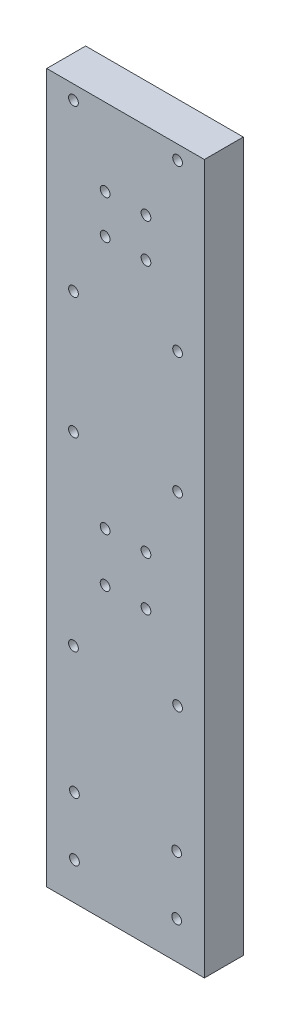
from build123d import *

# Parameters (mm, degrees)
SKETCH1_W           = 16.2
SKETCH1_H           = 72.846448831
SKETCH1_R           = 0.5
BOSS_EXTRUDE1_DEPTH = 4


with BuildPart() as part:
    # Sketch1 → Boss-Extrude1 (new body)
    with BuildSketch(Plane.XY):
        with Locations((8.1, 36.423224416)):
            Rectangle(SKETCH1_W, SKETCH1_H)
        with Locations((6, 29.846448831)):
            Circle(SKETCH1_R, mode=Mode.SUBTRACT)
        with Locations((10.2, 29.846448831)):
            Circle(SKETCH1_R, mode=Mode.SUBTRACT)
        with Locations((10.2, 34.892897662)):
            Circle(SKETCH1_R, mode=Mode.SUBTRACT)
        with Locations((10.2, 60.892897662)):
            Circle(SKETCH1_R, mode=Mode.SUBTRACT)
        with Locations((13.45, 54.392897662)):
            Circle(SKETCH1_R, mode=Mode.SUBTRACT)
        with Locations((6, 60.892897662)):
            Circle(SKETCH1_R, mode=Mode.SUBTRACT)
        with Locations((6, 34.892897662)):
            Circle(SKETCH1_R, mode=Mode.SUBTRACT)
        with Locations((2.75, 41.892897662)):
            Circle(SKETCH1_R, mode=Mode.SUBTRACT)
        with Locations((2.85, 9.846448831)):
            Circle(SKETCH1_R, mode=Mode.SUBTRACT)
        with Locations((13.35, 9.846448831)):
            Circle(SKETCH1_R, mode=Mode.SUBTRACT)
        with Locations((13.35, 3.846448831)):
            Circle(SKETCH1_R, mode=Mode.SUBTRACT)
        with Locations((2.85, 3.846448831)):
            Circle(SKETCH1_R, mode=Mode.SUBTRACT)
        with Locations((13.45, 41.892897662)):
            Circle(SKETCH1_R, mode=Mode.SUBTRACT)
        with Locations((2.75, 54.392897662)):
            Circle(SKETCH1_R, mode=Mode.SUBTRACT)
        with Locations((13.45, 22.846448831)):
            Circle(SKETCH1_R, mode=Mode.SUBTRACT)
        with Locations((2.75, 22.846448831)):
            Circle(SKETCH1_R, mode=Mode.SUBTRACT)
        with Locations((10.2, 64.892897662)):
            Circle(SKETCH1_R, mode=Mode.SUBTRACT)
        with Locations((13.45, 71.392897662)):
            Circle(SKETCH1_R, mode=Mode.SUBTRACT)
        with Locations((6, 64.892897662)):
            Circle(SKETCH1_R, mode=Mode.SUBTRACT)
        with Locations((2.75, 71.392897662)):
            Circle(SKETCH1_R, mode=Mode.SUBTRACT)
    extrude(amount=BOSS_EXTRUDE1_DEPTH)


solid = part.part
